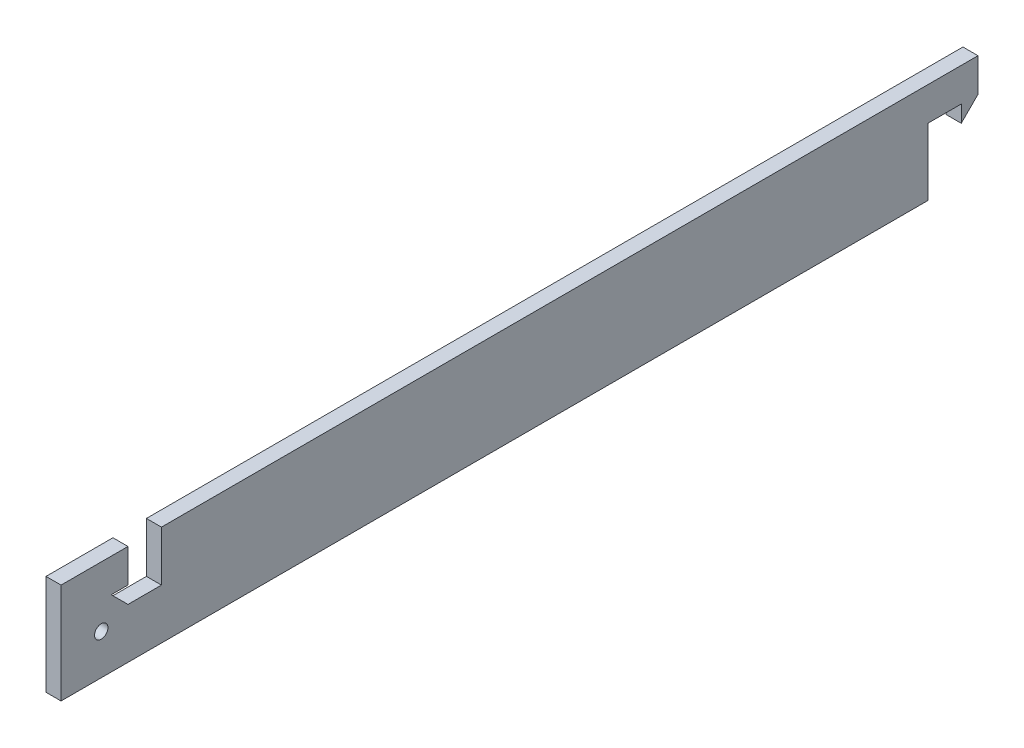
from build123d import *

# Parameters (mm, degrees)
SKETCH1_R           = 2
BOSS_EXTRUDE1_DEPTH = 4.5


with BuildPart() as part:
    # Sketch1 → Boss-Extrude1 (new body)
    with BuildSketch(Plane(origin=(0, 0, 0), x_dir=(0, 0, -1), z_dir=(1, 0, 0))):
        Polygon((-30.84603871, 0), (-40.84603871, 0), (-45.84603871, 5), (-40.84603871, 5), (-40.84603871, 15), (-60.84603871, 15), (-60.84603871, -15), (198.15396129, -15), (198.15396129, 5), (208.15396129, 5), (208.15396129, 0), (213.15396129, 5), (213.15396129, 15), (198.15396129, 15), (-30.84603871, 15), align=None)
        with Locations((-48.84603871, -3)):
            Circle(SKETCH1_R, mode=Mode.SUBTRACT)
    extrude(amount=BOSS_EXTRUDE1_DEPTH)


solid = part.part
